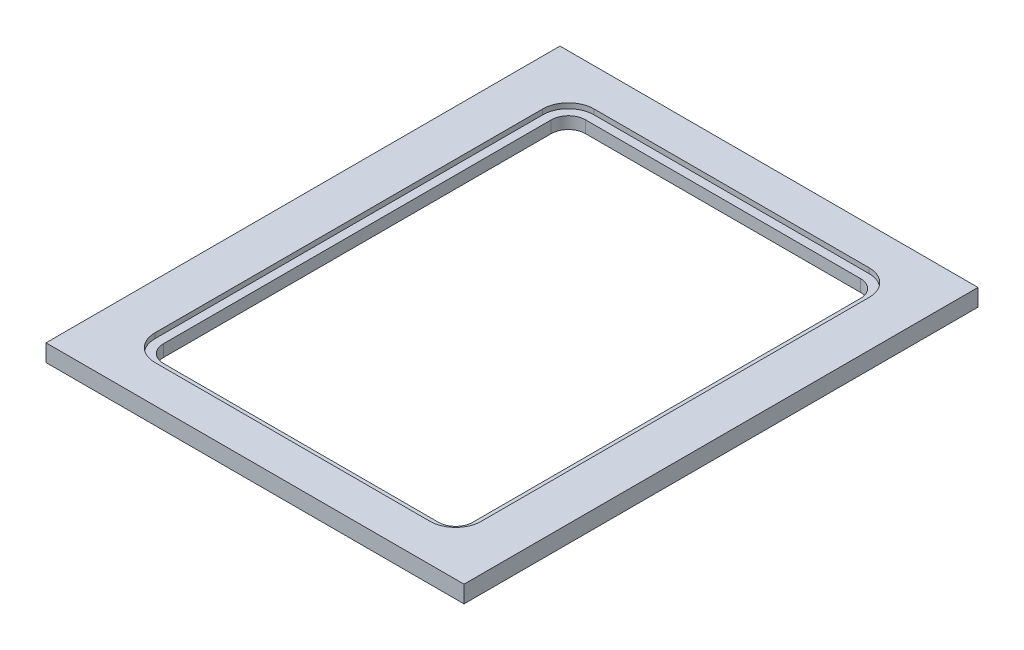
from build123d import *

# Parameters (mm, degrees)
SKETCH_1_W          = 244
SKETCH_1_H          = 300
SKETCH_1_W_2        = 180.532136394
SKETCH_1_H_2        = 246.344035898
EXTRUDE_1_DEPTH     = 10
FILLET_1_R          = 10
CUT_EXTRUDE_2_DEPTH = 3


with BuildPart() as part:
    # 草图1 → 凸台-拉伸1 (new body)
    with BuildSketch(Plane(origin=(0, 0, 0), x_dir=(1, 0, 0), z_dir=(0, 1, 0))):
        with Locations((122, -150)):
            Rectangle(SKETCH_1_W, SKETCH_1_H)
        with Locations((122, -150)):
            Rectangle(SKETCH_1_W_2, SKETCH_1_H_2, mode=Mode.SUBTRACT)
    extrude(amount=EXTRUDE_1_DEPTH)

    # 圆角1
    fillet_1_edges = [part.edges().sort_by_distance(p)[0] for p in [
        (31.733931803, 5, 273.172017949),
        (212.266068197, 5, 273.172017949),
        (31.733931803, 5, 26.827982051),
        (212.266068197, 5, 26.827982051),
    ]]
    fillet(fillet_1_edges, radius=FILLET_1_R)

    # 草图2 → 切除-拉伸2 (cut)
    with BuildSketch(Plane(origin=(0, 10, 0), x_dir=(1, 0, 0), z_dir=(0, 1, 0))):
        with BuildLine():
            Line((202.266068197, -21.827982051), (41.733931803, -21.827982051))
            ThreePointArc((41.733931803, -21.827982051), (31.127330085, -26.221380333), (26.733931803, -36.827982051))
            Line((26.733931803, -36.827982051), (26.733931803, -263.172017949))
            ThreePointArc((26.733931803, -263.172017949), (31.127330085, -273.778619667), (41.733931803, -278.172017949))
            Line((41.733931803, -278.172017949), (202.266068197, -278.172017949))
            ThreePointArc((202.266068197, -278.172017949), (212.872669915, -273.778619667), (217.266068197, -263.172017949))
            Line((217.266068197, -263.172017949), (217.266068197, -36.827982051))
            ThreePointArc((217.266068197, -36.827982051), (212.872669915, -26.221380333), (202.266068197, -21.827982051))
        make_face()
    extrude(amount=-CUT_EXTRUDE_2_DEPTH, mode=Mode.SUBTRACT)


solid = part.part
